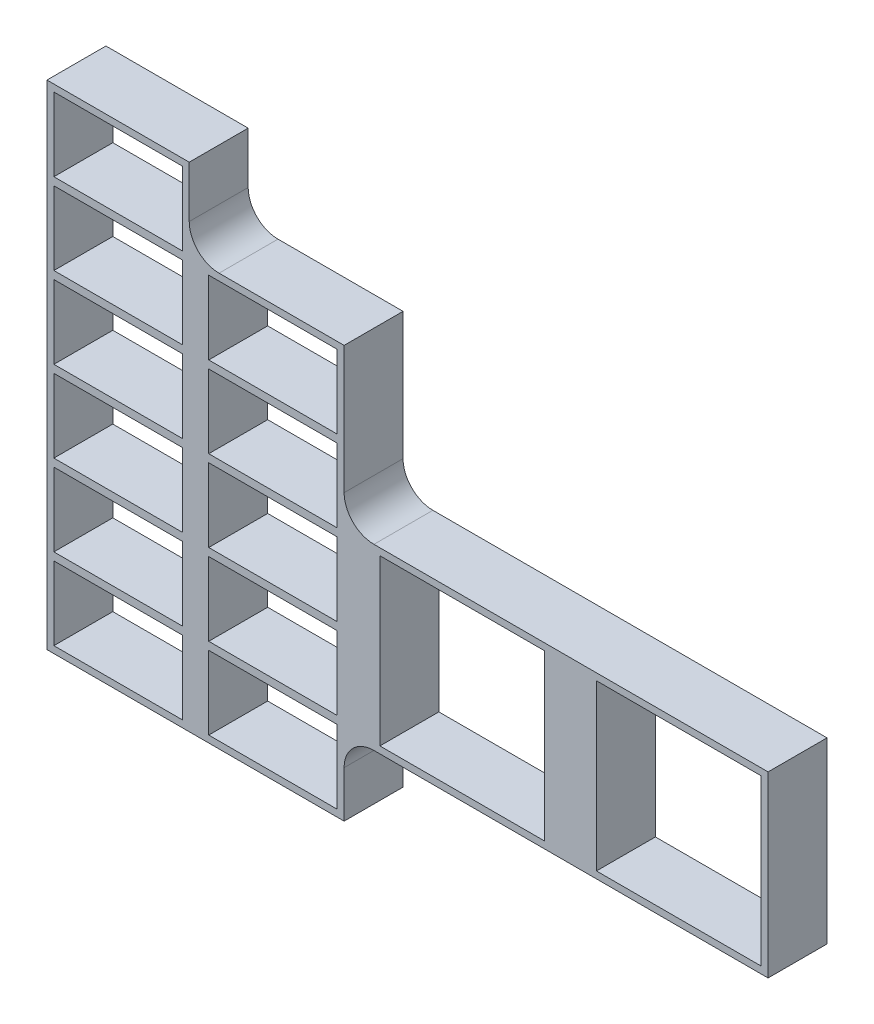
from build123d import *

# Parameters (mm, degrees)
EXTRUDE_THIN1_OUTLINE_W      = 19.7612
EXTRUDE_THIN1_OUTLINE_H      = 19.7612
EXTRUDE_THIN1_OUTLINE_W_2    = 18.2372
EXTRUDE_THIN1_OUTLINE_H_2    = 18.2372
EXTRUDE_THIN1_DEPTH          = 6.52585
EXTRUDE_THIN1_2_OUTLINE_W    = 15.748
EXTRUDE_THIN1_2_OUTLINE_H    = 9.652
EXTRUDE_THIN1_2_OUTLINE_W_2  = 14.224
EXTRUDE_THIN1_2_OUTLINE_H_2  = 8.128
EXTRUDE_THIN1_2_DEPTH        = 6.52585
EXTRUDE_THIN1_3_OUTLINE_W    = 15.748
EXTRUDE_THIN1_3_OUTLINE_H    = 9.652
EXTRUDE_THIN1_3_OUTLINE_W_2  = 14.224
EXTRUDE_THIN1_3_OUTLINE_H_2  = 8.128
EXTRUDE_THIN1_3_DEPTH        = 6.52585
EXTRUDE_THIN1_4_OUTLINE_W    = 15.748
EXTRUDE_THIN1_4_OUTLINE_H    = 9.652
EXTRUDE_THIN1_4_OUTLINE_W_2  = 14.224
EXTRUDE_THIN1_4_OUTLINE_H_2  = 8.128
EXTRUDE_THIN1_4_DEPTH        = 6.52585
EXTRUDE_THIN1_5_OUTLINE_W    = 15.748
EXTRUDE_THIN1_5_OUTLINE_H    = 9.652
EXTRUDE_THIN1_5_OUTLINE_W_2  = 14.224
EXTRUDE_THIN1_5_OUTLINE_H_2  = 8.128
EXTRUDE_THIN1_5_DEPTH        = 6.52585
EXTRUDE_THIN1_6_OUTLINE_W    = 15.748
EXTRUDE_THIN1_6_OUTLINE_H    = 9.652
EXTRUDE_THIN1_6_OUTLINE_W_2  = 14.224
EXTRUDE_THIN1_6_OUTLINE_H_2  = 8.128
EXTRUDE_THIN1_6_DEPTH        = 6.52585
EXTRUDE_THIN1_7_OUTLINE_W    = 15.748
EXTRUDE_THIN1_7_OUTLINE_H    = 9.652
EXTRUDE_THIN1_7_OUTLINE_W_2  = 14.224
EXTRUDE_THIN1_7_OUTLINE_H_2  = 8.128
EXTRUDE_THIN1_7_DEPTH        = 6.52585
EXTRUDE_THIN1_8_OUTLINE_W    = 15.748
EXTRUDE_THIN1_8_OUTLINE_H    = 9.652
EXTRUDE_THIN1_8_OUTLINE_W_2  = 14.224
EXTRUDE_THIN1_8_OUTLINE_H_2  = 8.128
EXTRUDE_THIN1_8_DEPTH        = 6.52585
EXTRUDE_THIN1_9_OUTLINE_W    = 15.748
EXTRUDE_THIN1_9_OUTLINE_H    = 9.652
EXTRUDE_THIN1_9_OUTLINE_W_2  = 14.224
EXTRUDE_THIN1_9_OUTLINE_H_2  = 8.128
EXTRUDE_THIN1_9_DEPTH        = 6.52585
EXTRUDE_THIN1_10_OUTLINE_W   = 15.748
EXTRUDE_THIN1_10_OUTLINE_H   = 9.652
EXTRUDE_THIN1_10_OUTLINE_W_2 = 14.224
EXTRUDE_THIN1_10_OUTLINE_H_2 = 8.128
EXTRUDE_THIN1_10_DEPTH       = 6.52585
EXTRUDE_THIN1_11_OUTLINE_W   = 15.748
EXTRUDE_THIN1_11_OUTLINE_H   = 9.652
EXTRUDE_THIN1_11_OUTLINE_W_2 = 14.224
EXTRUDE_THIN1_11_OUTLINE_H_2 = 8.128
EXTRUDE_THIN1_11_DEPTH       = 6.52585
EXTRUDE_THIN1_12_OUTLINE_W   = 15.748
EXTRUDE_THIN1_12_OUTLINE_H   = 9.652
EXTRUDE_THIN1_12_OUTLINE_W_2 = 14.224
EXTRUDE_THIN1_12_OUTLINE_H_2 = 8.128
EXTRUDE_THIN1_12_DEPTH       = 6.52585
EXTRUDE_THIN1_13_OUTLINE_W   = 19.7612
EXTRUDE_THIN1_13_OUTLINE_H   = 19.7612
EXTRUDE_THIN1_13_OUTLINE_W_2 = 18.2372
EXTRUDE_THIN1_13_OUTLINE_H_2 = 18.2372
EXTRUDE_THIN1_13_DEPTH       = 6.52585
BOSS_EXTRUDE1_START          = -6.52585
SKETCH3_W                    = 1.397
SKETCH3_H                    = 45.6184
SKETCH3_W_2                  = 3.2004
SKETCH3_H_2                  = 19.7612
SKETCH3_W_3                  = 4.212549516
BOSS_EXTRUDE1_DEPTH          = 6.52585
FILLET1_R                    = 3.302


# Read off the part's stored shape, not the designer's step: Extrude-Thin1
with BuildPart() as part:
    # Extrude-Thin1 outline → Extrude-Thin1 (new body)
    with BuildSketch(Plane.XY):
        with Locations((610.948497092, 512.7244)):
            Rectangle(EXTRUDE_THIN1_OUTLINE_W, EXTRUDE_THIN1_OUTLINE_H)
        with Locations((610.948497092, 512.7244)):
            Rectangle(EXTRUDE_THIN1_OUTLINE_W_2, EXTRUDE_THIN1_OUTLINE_H_2, mode=Mode.SUBTRACT)
    extrude(amount=EXTRUDE_THIN1_DEPTH)



with BuildPart() as body_2:
    # Extrude-Thin1 2 outline → Extrude-Thin1 2 (new body)
    with BuildSketch(Plane.XY):
        with Locations((548.874747576, 544.195)):
            Rectangle(EXTRUDE_THIN1_2_OUTLINE_W, EXTRUDE_THIN1_2_OUTLINE_H)
        with Locations((548.874747576, 544.195)):
            Rectangle(EXTRUDE_THIN1_2_OUTLINE_W_2, EXTRUDE_THIN1_2_OUTLINE_H_2, mode=Mode.SUBTRACT)
    extrude(amount=EXTRUDE_THIN1_2_DEPTH)


with BuildPart() as body_3:
    # Extrude-Thin1 3 outline → Extrude-Thin1 3 (new body)
    with BuildSketch(Plane.XY):
        with Locations((548.874747576, 535.2034)):
            Rectangle(EXTRUDE_THIN1_3_OUTLINE_W, EXTRUDE_THIN1_3_OUTLINE_H)
        with Locations((548.874747576, 535.2034)):
            Rectangle(EXTRUDE_THIN1_3_OUTLINE_W_2, EXTRUDE_THIN1_3_OUTLINE_H_2, mode=Mode.SUBTRACT)
    extrude(amount=EXTRUDE_THIN1_3_DEPTH)


with BuildPart() as body_4:
    # Extrude-Thin1 4 outline → Extrude-Thin1 4 (new body)
    with BuildSketch(Plane.XY):
        with Locations((548.874747576, 526.2118)):
            Rectangle(EXTRUDE_THIN1_4_OUTLINE_W, EXTRUDE_THIN1_4_OUTLINE_H)
        with Locations((548.874747576, 526.2118)):
            Rectangle(EXTRUDE_THIN1_4_OUTLINE_W_2, EXTRUDE_THIN1_4_OUTLINE_H_2, mode=Mode.SUBTRACT)
    extrude(amount=EXTRUDE_THIN1_4_DEPTH)


with BuildPart() as body_5:
    # Extrude-Thin1 5 outline → Extrude-Thin1 5 (new body)
    with BuildSketch(Plane.XY):
        with Locations((548.874747576, 517.2202)):
            Rectangle(EXTRUDE_THIN1_5_OUTLINE_W, EXTRUDE_THIN1_5_OUTLINE_H)
        with Locations((548.874747576, 517.2202)):
            Rectangle(EXTRUDE_THIN1_5_OUTLINE_W_2, EXTRUDE_THIN1_5_OUTLINE_H_2, mode=Mode.SUBTRACT)
    extrude(amount=EXTRUDE_THIN1_5_DEPTH)


with BuildPart() as body_6:
    # Extrude-Thin1 6 outline → Extrude-Thin1 6 (new body)
    with BuildSketch(Plane.XY):
        with Locations((548.874747576, 508.2286)):
            Rectangle(EXTRUDE_THIN1_6_OUTLINE_W, EXTRUDE_THIN1_6_OUTLINE_H)
        with Locations((548.874747576, 508.2286)):
            Rectangle(EXTRUDE_THIN1_6_OUTLINE_W_2, EXTRUDE_THIN1_6_OUTLINE_H_2, mode=Mode.SUBTRACT)
    extrude(amount=EXTRUDE_THIN1_6_DEPTH)


with BuildPart() as body_7:
    # Extrude-Thin1 7 outline → Extrude-Thin1 7 (new body)
    with BuildSketch(Plane.XY):
        with Locations((548.874747576, 499.237)):
            Rectangle(EXTRUDE_THIN1_7_OUTLINE_W, EXTRUDE_THIN1_7_OUTLINE_H)
        with Locations((548.874747576, 499.237)):
            Rectangle(EXTRUDE_THIN1_7_OUTLINE_W_2, EXTRUDE_THIN1_7_OUTLINE_H_2, mode=Mode.SUBTRACT)
    extrude(amount=EXTRUDE_THIN1_7_DEPTH)


with BuildPart() as body_8:
    # Extrude-Thin1 8 outline → Extrude-Thin1 8 (new body)
    with BuildSketch(Plane.XY):
        with Locations((566.019747576, 499.237)):
            Rectangle(EXTRUDE_THIN1_8_OUTLINE_W, EXTRUDE_THIN1_8_OUTLINE_H)
        with Locations((566.019747576, 499.237)):
            Rectangle(EXTRUDE_THIN1_8_OUTLINE_W_2, EXTRUDE_THIN1_8_OUTLINE_H_2, mode=Mode.SUBTRACT)
    extrude(amount=EXTRUDE_THIN1_8_DEPTH)


with BuildPart() as body_9:
    # Extrude-Thin1 9 outline → Extrude-Thin1 9 (new body)
    with BuildSketch(Plane.XY):
        with Locations((566.019747576, 508.2286)):
            Rectangle(EXTRUDE_THIN1_9_OUTLINE_W, EXTRUDE_THIN1_9_OUTLINE_H)
        with Locations((566.019747576, 508.2286)):
            Rectangle(EXTRUDE_THIN1_9_OUTLINE_W_2, EXTRUDE_THIN1_9_OUTLINE_H_2, mode=Mode.SUBTRACT)
    extrude(amount=EXTRUDE_THIN1_9_DEPTH)


with BuildPart() as body_10:
    # Extrude-Thin1 10 outline → Extrude-Thin1 10 (new body)
    with BuildSketch(Plane.XY):
        with Locations((566.019747576, 517.2202)):
            Rectangle(EXTRUDE_THIN1_10_OUTLINE_W, EXTRUDE_THIN1_10_OUTLINE_H)
        with Locations((566.019747576, 517.2202)):
            Rectangle(EXTRUDE_THIN1_10_OUTLINE_W_2, EXTRUDE_THIN1_10_OUTLINE_H_2, mode=Mode.SUBTRACT)
    extrude(amount=EXTRUDE_THIN1_10_DEPTH)


with BuildPart() as body_11:
    # Extrude-Thin1 11 outline → Extrude-Thin1 11 (new body)
    with BuildSketch(Plane.XY):
        with Locations((566.019747576, 535.2034)):
            Rectangle(EXTRUDE_THIN1_11_OUTLINE_W, EXTRUDE_THIN1_11_OUTLINE_H)
        with Locations((566.019747576, 535.2034)):
            Rectangle(EXTRUDE_THIN1_11_OUTLINE_W_2, EXTRUDE_THIN1_11_OUTLINE_H_2, mode=Mode.SUBTRACT)
    extrude(amount=EXTRUDE_THIN1_11_DEPTH)


with BuildPart() as body_12:
    # Extrude-Thin1 12 outline → Extrude-Thin1 12 (new body)
    with BuildSketch(Plane.XY):
        with Locations((566.019747576, 526.2118)):
            Rectangle(EXTRUDE_THIN1_12_OUTLINE_W, EXTRUDE_THIN1_12_OUTLINE_H)
        with Locations((566.019747576, 526.2118)):
            Rectangle(EXTRUDE_THIN1_12_OUTLINE_W_2, EXTRUDE_THIN1_12_OUTLINE_H_2, mode=Mode.SUBTRACT)
    extrude(amount=EXTRUDE_THIN1_12_DEPTH)


with BuildPart() as body_13:
    # Extrude-Thin1 13 outline → Extrude-Thin1 13 (new body)
    with BuildSketch(Plane.XY):
        with Locations((586.974747576, 512.7244)):
            Rectangle(EXTRUDE_THIN1_13_OUTLINE_W, EXTRUDE_THIN1_13_OUTLINE_H)
        with Locations((586.974747576, 512.7244)):
            Rectangle(EXTRUDE_THIN1_13_OUTLINE_W_2, EXTRUDE_THIN1_13_OUTLINE_H_2, mode=Mode.SUBTRACT)
    extrude(amount=EXTRUDE_THIN1_13_DEPTH)


with BuildPart() as part_1:
    add(part.part)

    add(body_2.part)  # Boss-Extrude1 merges body 2

    add(body_3.part)  # Boss-Extrude1 merges body 3

    add(body_4.part)  # Boss-Extrude1 merges body 4

    add(body_5.part)  # Boss-Extrude1 merges body 5

    add(body_6.part)  # Boss-Extrude1 merges body 6

    add(body_7.part)  # Boss-Extrude1 merges body 7

    add(body_8.part)  # Boss-Extrude1 merges body 8

    add(body_9.part)  # Boss-Extrude1 merges body 9

    add(body_10.part)  # Boss-Extrude1 merges body 10

    add(body_11.part)  # Boss-Extrude1 merges body 11

    add(body_12.part)  # Boss-Extrude1 merges body 12

    add(body_13.part)  # Boss-Extrude1 merges body 13
    # Sketch3 → Boss-Extrude1 (add)
    with BuildSketch(Plane.XY.offset(6.52585).offset(BOSS_EXTRUDE1_START)):
        with Locations((557.447247576, 517.2202)):
            Rectangle(SKETCH3_W, SKETCH3_H)
        with Locations((575.493947576, 512.7244)):
            Rectangle(SKETCH3_W_2, SKETCH3_H_2)
        with Locations((598.961622334, 512.7244)):
            Rectangle(SKETCH3_W_3, SKETCH3_H_2)
    extrude(amount=BOSS_EXTRUDE1_DEPTH)

    # Fillet1
    fillet1_edges = [part_1.edges().sort_by_distance(p)[0] for p in [
        (556.748747576, 540.0294, 3.262925),
        (573.893747576, 502.8438, 3.262925),
        (573.893747576, 522.605, 3.262925),
    ]]
    fillet(fillet1_edges, radius=FILLET1_R)


solid = part_1.part
